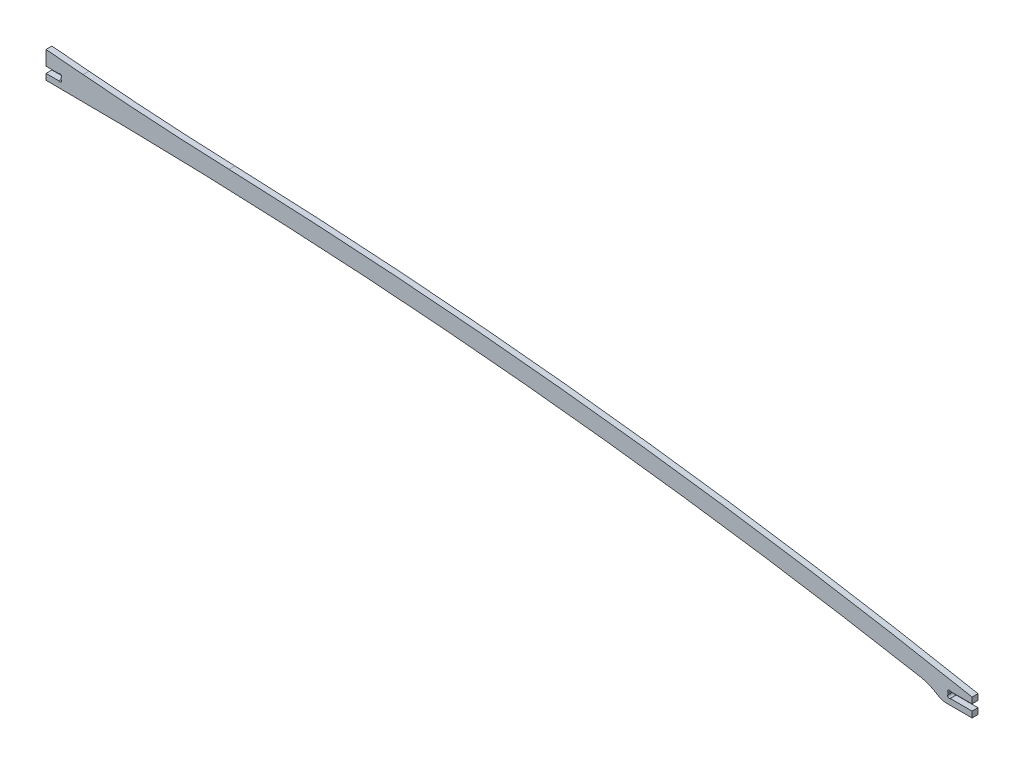
from build123d import *

# Parameters (mm, degrees)
EXTRUDE_1_DEPTH     = 1
EXTRUDE_2_DEPTH     = 2
SKETCH_2_3_W        = 8.1
SKETCH_2_3_H        = 1.05
CUT_EXTRUDE_1_DEPTH = 1673.067193133
EXTRUDE_3_DEPTH     = 2
FILLET_1_R          = 1000
SKETCH_4_W          = 5.1
SKETCH_4_H          = 2.1
CUT_EXTRUDE_2_DEPTH = 1676.014424819
CUT_EXTRUDE_3_DEPTH = 10
FILLET_2_R          = 0.3
FILLET_3_R          = 15
FILLET_4_R          = 5


with BuildPart() as part:
    # 草图1 → 凸台-拉伸1 (new, symmetric)
    with BuildSketch(Plane.XY):
        with BuildLine():
            Line((279.250783347, 1612.604166667), (312.5, 1612.604166667))
            ThreePointArc((312.5, 1612.604166667), (156.96834872, 1635.086965837), (0, 1642.604166667))
            Line((0, 1642.604166667), (0, 1636.604166667))
            ThreePointArc((0, 1636.604166667), (140.140108463, 1630.593127776), (279.250783347, 1612.604166667))
        make_face()
        with BuildLine():
            ThreePointArc((279.250783347, 1612.604166667), (295.891173678, 1609.633999296), (312.5, 1606.492125207))
            Line((312.5, 1606.492125207), (312.5, 1612.604166667))
            Line((312.5, 1612.604166667), (279.250783347, 1612.604166667))
        make_face()
    extrude(amount=EXTRUDE_1_DEPTH, both=True)

    # 草图2 → 凸台-拉伸2 (add)
    with BuildSketch(Plane.XY.offset(1)):
        with BuildLine():
            Line((304.4, 1608.498145937), (304.4, 1609.548145937))
            Line((304.4, 1609.548145937), (304.4, 1610.598145937))
            Line((304.4, 1610.598145937), (297.605619779, 1609.317896945))
            ThreePointArc((297.605619779, 1609.317896945), (305.056081841, 1607.922257226), (312.5, 1606.492125207))
            Line((312.5, 1606.492125207), (312.5, 1608.498145937))
            Line((312.5, 1608.498145937), (304.4, 1608.498145937))
        make_face()
        with BuildLine():
            Line((302.5, 1606.492125207), (312.5, 1606.492125207))
            ThreePointArc((312.5, 1606.492125207), (305.056081841, 1607.922257226), (297.605619779, 1609.317896945))
            Line((297.605619779, 1609.317896945), (302.5, 1606.492125207))
        make_face()
    extrude(amount=-EXTRUDE_2_DEPTH)

    # 草图2<3> → 切除-拉伸1 (cut, through all)
    with BuildSketch(Plane.XY.offset(1)):
        with Locations((308.45, 1610.073145937)):
            Rectangle(SKETCH_2_3_W, SKETCH_2_3_H)
        with Locations((308.45, 1609.023145937)):
            Rectangle(SKETCH_2_3_W, SKETCH_2_3_H)
    extrude(amount=-CUT_EXTRUDE_1_DEPTH, mode=Mode.SUBTRACT)

    # 草图3 → 凸台-拉伸3 (add)
    with BuildSketch(Plane.XY.offset(1)):
        with BuildLine():
            Line((0, 1645.604166667), (0, 1642.604166667))
            ThreePointArc((0, 1642.604166667), (20.001482883, 1642.482386217), (40, 1642.117062925))
            Line((40, 1642.117062925), (0, 1645.604166667))
        make_face()
    extrude(amount=-EXTRUDE_3_DEPTH)

    # 圆角1
    # the kernel refuses this fillet: 1000 mm, written as the material it adds along each edge
    with BuildSketch(Plane(origin=(40, 1642.117062925, 1), x_dir=(-0.9962215569396788, 0.08684819795874989, 0), z_dir=(0, 0, -1))) as fillet_1_piece_1:
        with BuildLine():
            CenterArc((27.604593051, 1000), FILLET_1_R, 267.172213378, 2.827786622)
            ThreePointArc((-21.729560043, 1.217670692), (-10.862763311, 0.644823912), (0, 0))
            Line((0, 0), (27.604593051, 0))
        make_face()
    extrude(amount=2)

    # 草图4 → 切除-拉伸2 (cut, through all)
    with BuildSketch(Plane.XY.offset(1)):
        with Locations((2.55, 1639.654166667)):
            Rectangle(SKETCH_4_W, SKETCH_4_H)
    extrude(amount=-CUT_EXTRUDE_2_DEPTH, mode=Mode.SUBTRACT)

    # 草图5 → 切除-拉伸3 (cut)
    with BuildSketch(Plane.XY.offset(1)):
        with BuildLine():
            Line((304.4, 1608.498145937), (304.4, 1609.205252718))
            ThreePointArc((304.4, 1609.205252718), (304.253553391, 1608.851699327), (304.4, 1608.498145937))
        make_face()
        with BuildLine():
            Line((305.107106781, 1608.498145937), (304.4, 1608.498145937))
            ThreePointArc((304.4, 1608.498145937), (304.753553391, 1608.351699327), (305.107106781, 1608.498145937))
        make_face()
        with BuildLine():
            ThreePointArc((304.4, 1610.598145937), (304.253553391, 1610.244592546), (304.4, 1609.891039155))
            Line((304.4, 1609.891039155), (304.4, 1610.598145937))
        make_face()
        with BuildLine():
            Line((304.4, 1610.598145937), (305.107106781, 1610.598145937))
            ThreePointArc((305.107106781, 1610.598145937), (304.753553391, 1610.744592546), (304.4, 1610.598145937))
        make_face()
        with BuildLine():
            ThreePointArc((5.1, 1639.997059885), (5.208386376, 1640.15927156), (5.246446609, 1640.350613276))
            ThreePointArc((5.246446609, 1640.350613276), (5.208386376, 1640.541954992), (5.1, 1640.704166667))
            Line((5.1, 1640.704166667), (5.1, 1639.997059885))
        make_face()
        with BuildLine():
            Line((4.392893219, 1640.704166667), (5.1, 1640.704166667))
            ThreePointArc((5.1, 1640.704166667), (4.746446609, 1640.850613276), (4.392893219, 1640.704166667))
        make_face()
        with BuildLine():
            ThreePointArc((5.246446609, 1638.957720057), (5.208386376, 1639.149061773), (5.1, 1639.311273448))
            Line((5.1, 1639.311273448), (5.1, 1638.604166667))
            ThreePointArc((5.1, 1638.604166667), (5.208386376, 1638.766378341), (5.246446609, 1638.957720057))
        make_face()
        with BuildLine():
            Line((5.1, 1638.604166667), (4.392893219, 1638.604166667))
            ThreePointArc((4.392893219, 1638.604166667), (4.746446609, 1638.457720057), (5.1, 1638.604166667))
        make_face()
    extrude(amount=-CUT_EXTRUDE_3_DEPTH, mode=Mode.SUBTRACT)

    # 圆角2
    fillet_2_edges = [part.edges().sort_by_distance(p)[0] for p in [
        (4.392893219, 1638.604166667, 0),
        (5.1, 1639.997059885, 0),
        (304.4, 1609.205252718, 0),
        (305.107106781, 1610.598145937, 0),
        (305.107106781, 1608.498145937, 0),
        (304.4, 1609.891039155, 0),
        (4.392893219, 1640.704166667, 0),
        (5.1, 1639.311273448, 0),
    ]]
    fillet(fillet_2_edges, radius=FILLET_2_R)

    # 圆角3
    fillet_3_edges = [part.edges().sort_by_distance(p)[0] for p in [
        (297.605619779, 1609.317896945, 0),
    ]]
    fillet(fillet_3_edges, radius=FILLET_3_R)

    # 圆角4
    fillet_4_edges = [part.edges().sort_by_distance(p)[0] for p in [
        (302.5, 1606.492125207, 0),
    ]]
    fillet(fillet_4_edges, radius=FILLET_4_R)


solid = part.part
